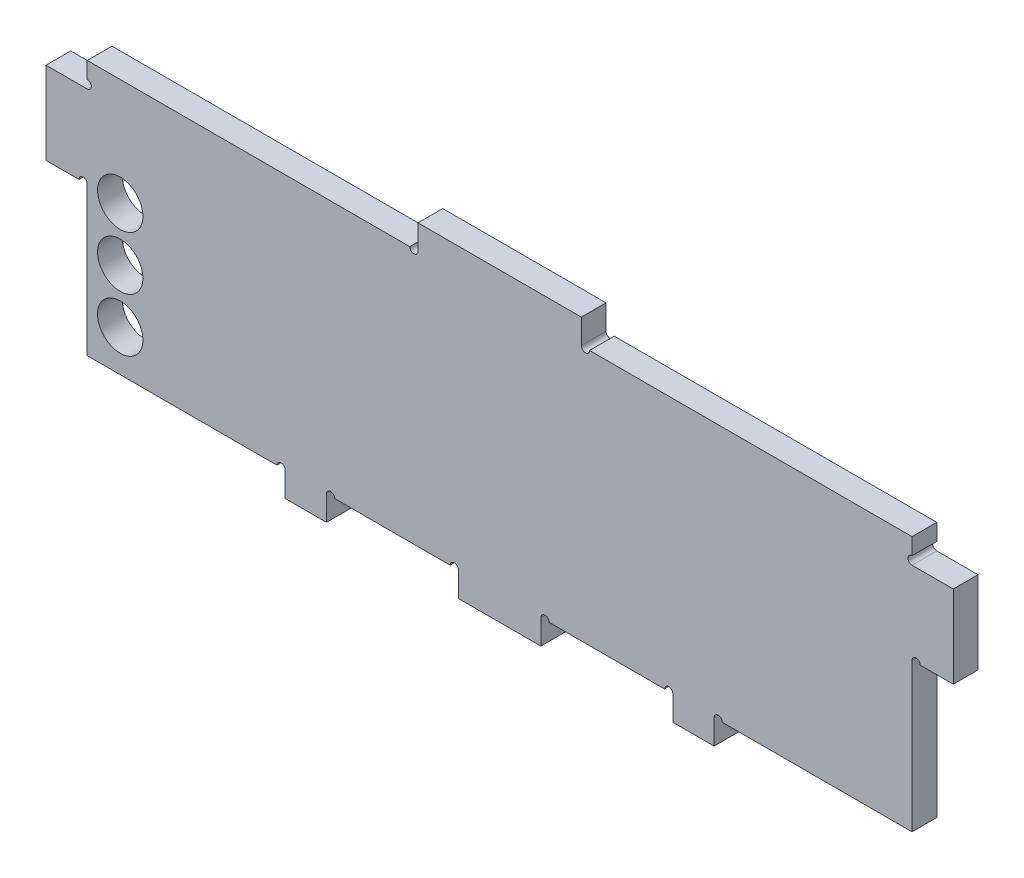
from build123d import *

# Parameters (mm, degrees)
SKETCH1_R           = 2.75
BOSS_EXTRUDE1_DEPTH = 3
SKETCH4_W           = 19.8
SKETCH4_H           = 3
BOSS_EXTRUDE2_DEPTH = 3
CUT_EXTRUDE2_DEPTH  = 67.355105305


with BuildPart() as part:
    # Sketch1 → Boss-Extrude1 (new body)
    with BuildSketch(Plane.XY):
        Polygon((-5, 0), (5, 0), (5, 3), (21, 3), (21, 0), (26, 0), (26, 3), (50, 3), (50, 21), (55, 21), (55, 31), (50, 31), (50, 34), (0, 34), (-50, 34), (-50, 31), (-55, 31), (-55, 21), (-50, 21), (-50, 3), (-26, 3), (-26, 0), (-21, 0), (-21, 3), (-5, 3), align=None)
        with Locations((-46, 8)):
            Circle(SKETCH1_R, mode=Mode.SUBTRACT)
        with Locations((-46, 14.5)):
            Circle(SKETCH1_R, mode=Mode.SUBTRACT)
        with Locations((-46, 21)):
            Circle(SKETCH1_R, mode=Mode.SUBTRACT)
    extrude(amount=BOSS_EXTRUDE1_DEPTH)

    # Sketch4 → Boss-Extrude2 (add)
    with BuildSketch(Plane.XY.offset(3)):
        with Locations((0, 35.5)):
            Rectangle(SKETCH4_W, SKETCH4_H)
    extrude(amount=-BOSS_EXTRUDE2_DEPTH)

    # Sketch3 → Cut-Extrude2 (cut, through all)
    with BuildSketch(Plane.XY.offset(3)):
        with BuildLine():
            ThreePointArc((21, 3), (20.5, 3.5), (20, 3))
            Line((20, 3), (21, 3))
        make_face()
        with BuildLine():
            ThreePointArc((6, 3), (5.5, 3.5), (5, 3))
            Line((5, 3), (6, 3))
        make_face()
        with BuildLine():
            ThreePointArc((27, 3), (26.5, 3.5), (26, 3))
            Line((26, 3), (27, 3))
        make_face()
        with BuildLine():
            ThreePointArc((51, 21), (50.5, 21.5), (50, 21))
            Line((50, 21), (51, 21))
        make_face()
        with BuildLine():
            ThreePointArc((9.9, 34), (10.4, 33.5), (10.9, 34))
            Line((10.9, 34), (9.9, 34))
        make_face()
        with BuildLine():
            ThreePointArc((50, 32), (49.5, 31.5), (50, 31))
            Line((50, 31), (50, 32))
        make_face()
        with BuildLine():
            Line((-50, 32), (-50, 31))
            ThreePointArc((-50, 31), (-49.5, 31.5), (-50, 32))
        make_face()
        with BuildLine():
            Line((-9.9, 34), (-10.9, 34))
            ThreePointArc((-10.9, 34), (-10.4, 33.5), (-9.9, 34))
        make_face()
        with BuildLine():
            Line((-51, 21), (-50, 21))
            ThreePointArc((-50, 21), (-50.5, 21.5), (-51, 21))
        make_face()
        with BuildLine():
            Line((-27, 3), (-26, 3))
            ThreePointArc((-26, 3), (-26.5, 3.5), (-27, 3))
        make_face()
        with BuildLine():
            ThreePointArc((-5, 3), (-5.5, 3.5), (-6, 3))
            Line((-6, 3), (-5, 3))
        make_face()
        with BuildLine():
            ThreePointArc((-20, 3), (-20.5, 3.5), (-21, 3))
            Line((-21, 3), (-20, 3))
        make_face()
    extrude(amount=-CUT_EXTRUDE2_DEPTH, mode=Mode.SUBTRACT)


solid = part.part
